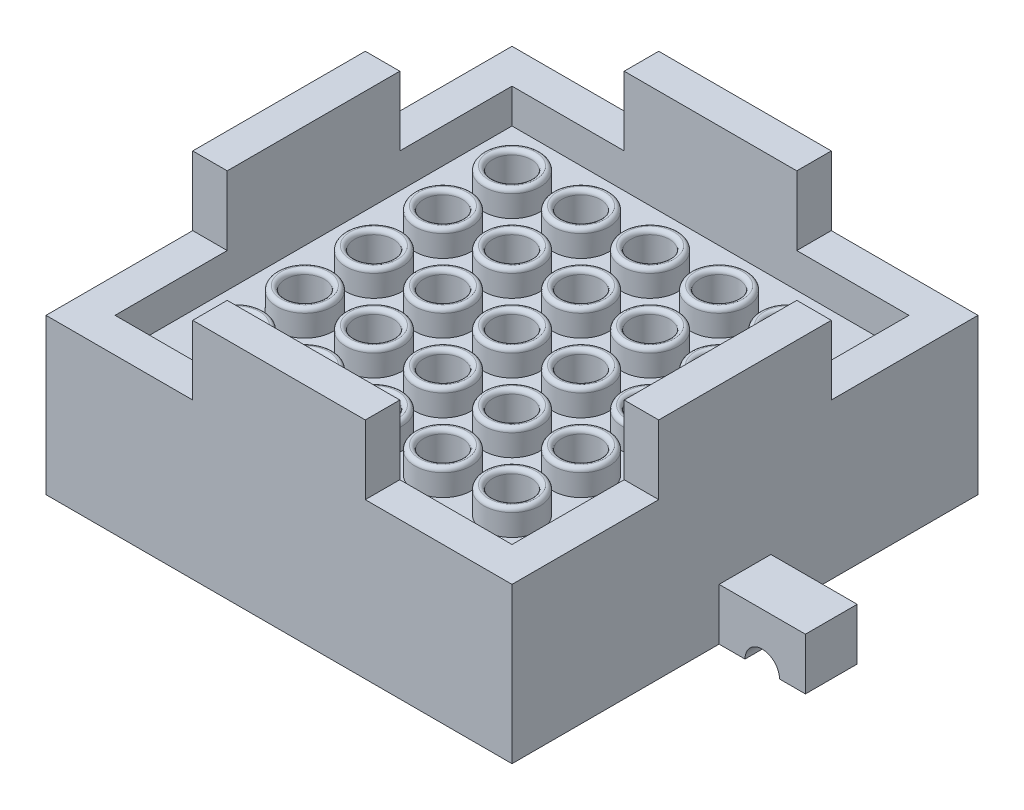
from build123d import *

# Parameters (mm, degrees)
SKETCH1_W              = 27
SKETCH1_H              = 27
SKETCH1_W_2            = 23
SKETCH1_H_2            = 23
BOSS_EXTRUDE1_DEPTH    = 2
SKETCH2_W              = 27
SKETCH2_H              = 27
BOSS_EXTRUDE2_DEPTH    = 2
SKETCH3_W              = 27
SKETCH3_H              = 27
SKETCH3_W_2            = 23
SKETCH3_H_2            = 23
BOSS_EXTRUDE3_DEPTH    = 3
SKETCH6_R              = 1.625
BOSS_EXTRUDE5_DEPTH    = 1.5
CUT_EXTRUDE2_REACH     = 22.168
SKETCH7_R              = 1.125
FILLET1_R              = 0.25
LPATTERN3_COUNT        = 5
LPATTERN3_PITCH        = 4
LPATTERN3_COUNT_DIR2   = 5
LPATTERN3_PITCH_DIR2   = 4
FILLET1_OF_LPATTERN3_R = 0.25
SKETCH11_R             = 0.75
BOSS_EXTRUDE8_DEPTH    = 3
LPATTERN2_COUNT        = 6
LPATTERN2_PITCH        = 4
LPATTERN2_COUNT_DIR2   = 6
LPATTERN2_PITCH_DIR2   = 4
SKETCH8_W              = 27
SKETCH8_H              = 27
BOSS_EXTRUDE6_DEPTH    = 2
SKETCH9_R              = 4.25
CUT_EXTRUDE3_DEPTH     = 5
SKETCH10_W             = 2
SKETCH10_H             = 10
BOSS_EXTRUDE7_DEPTH    = 4
CIRPATTERN2_COUNT      = 4
SKETCH12_W             = 3
SKETCH12_H             = 3
BOSS_EXTRUDE9_DEPTH    = 5
CUT_EXTRUDE4_START     = -3
CUT_EXTRUDE4_DEPTH     = 3
CUT_EXTRUDE4_2_DEPTH   = 3


# Read off the part's stored shape, not the designer's step: Cut-Extrude4
with BuildPart() as part:
    # Sketch1 → Boss-Extrude1 (new body)
    with BuildSketch(Plane(origin=(0, 0, 0), x_dir=(1, 0, 0), z_dir=(0, 1, 0))):
        Rectangle(SKETCH1_W, SKETCH1_H)
        Rectangle(SKETCH1_W_2, SKETCH1_H_2, mode=Mode.SUBTRACT)
    extrude(amount=BOSS_EXTRUDE1_DEPTH)

    # Sketch2 → Boss-Extrude2 (add)
    with BuildSketch(Plane.XZ):
        Rectangle(SKETCH2_W, SKETCH2_H)
    extrude(amount=BOSS_EXTRUDE2_DEPTH)

    # Sketch3 → Boss-Extrude3 (add)
    with BuildSketch(Plane.XZ.offset(2)):
        Rectangle(SKETCH3_W, SKETCH3_H)
        Rectangle(SKETCH3_W_2, SKETCH3_H_2, mode=Mode.SUBTRACT)
    extrude(amount=BOSS_EXTRUDE3_DEPTH)

    # Sketch6 → Boss-Extrude5 (add)
    with BuildSketch(Plane(origin=(0, 0, 0), x_dir=(1, 0, 0), z_dir=(0, 1, 0))):
        with Locations(Location((8, 8, 0), (0, 0, 90))):
            Circle(SKETCH6_R)
    boss_extrude5 = extrude(amount=BOSS_EXTRUDE5_DEPTH)

    # Sketch7 → Cut-Extrude2 (cut, up to next)
    with BuildSketch(Plane(origin=(0, 1.5, 0), x_dir=(1, 0, 0), z_dir=(0, 1, 0)), mode=Mode.PRIVATE) as cut_extrude2_sk1:
        with Locations(Location((8, 8, 0), (0, 0, 270))):
            Circle(SKETCH7_R)
    cut_extrude2_tool1 = extrude(cut_extrude2_sk1.sketch, amount=-CUT_EXTRUDE2_REACH, mode=Mode.PRIVATE) & part.part
    cut_extrude2 = cut_extrude2_tool1.solids().sort_by_distance((8, 1.5, -8))[0]
    add(cut_extrude2, mode=Mode.SUBTRACT)

    # Fillet1
    fillet1_edges = [part.edges().sort_by_distance(p)[0] for p in [
        (8, 1.5, -6.375),
        (8, 1.5, -9.125),
    ]]
    fillet(fillet1_edges, radius=FILLET1_R - 0.0001)  # a hair under: the kernel refuses the full size

    # LPattern3: Boss-Extrude5, Cut-Extrude2 5 × 5
    with Locations(*[(-j * LPATTERN3_PITCH_DIR2, 0, i * LPATTERN3_PITCH) for i in range(LPATTERN3_COUNT) for j in range(LPATTERN3_COUNT_DIR2) if (i, j) != (0, 0)]):
        add(boss_extrude5)
        add(cut_extrude2, mode=Mode.SUBTRACT)

    # Fillet1 of LPattern3
    fillet1_of_lpattern3_edges = [part.edges().sort_by_distance(p)[0] for p in [
        (4, 1.5, -6.375),
        (4, 1.5, -9.125),
        (0, 1.5, -6.375),
        (0, 1.5, -9.125),
        (-4, 1.5, -6.375),
        (-4, 1.5, -9.125),
        (-8, 1.5, -6.375),
        (-8, 1.5, -9.125),
        (8, 1.5, -2.375),
        (8, 1.5, -5.125),
        (4, 1.5, -2.375),
        (4, 1.5, -5.125),
        (0, 1.5, -2.375),
        (0, 1.5, -5.125),
        (-4, 1.5, -2.375),
        (-4, 1.5, -5.125),
        (-8, 1.5, -2.375),
        (-8, 1.5, -5.125),
        (8, 1.5, 1.625),
        (8, 1.5, -1.125),
        (4, 1.5, 1.625),
        (4, 1.5, -1.125),
        (0, 1.5, 1.625),
        (0, 1.5, -1.125),
        (-4, 1.5, 1.625),
        (-4, 1.5, -1.125),
        (-8, 1.5, 1.625),
        (-8, 1.5, -1.125),
        (8, 1.5, 5.625),
        (8, 1.5, 2.875),
        (4, 1.5, 5.625),
        (4, 1.5, 2.875),
        (0, 1.5, 5.625),
        (0, 1.5, 2.875),
        (-4, 1.5, 5.625),
        (-4, 1.5, 2.875),
        (-8, 1.5, 5.625),
        (-8, 1.5, 2.875),
        (8, 1.5, 9.625),
        (8, 1.5, 6.875),
        (4, 1.5, 9.625),
        (4, 1.5, 6.875),
        (0, 1.5, 9.625),
        (0, 1.5, 6.875),
        (-4, 1.5, 9.625),
        (-4, 1.5, 6.875),
        (-8, 1.5, 9.625),
        (-8, 1.5, 6.875),
    ]]
    fillet(fillet1_of_lpattern3_edges, radius=FILLET1_OF_LPATTERN3_R - 0.0001)  # a hair under: the kernel refuses the full size

    # Sketch11 → Boss-Extrude8 (add)
    with BuildSketch(Plane.XZ.offset(2)):
        with Locations(Location((-9.9, 9.9, 0), (0, 0, 90))):
            Circle(SKETCH11_R)
    boss_extrude8 = extrude(amount=BOSS_EXTRUDE8_DEPTH)

    # LPattern2: Boss-Extrude8 6 × 6
    with Locations(*[(i * LPATTERN2_PITCH, 0, -j * LPATTERN2_PITCH_DIR2) for i in range(LPATTERN2_COUNT) for j in range(LPATTERN2_COUNT_DIR2) if (i, j) != (0, 0)]):
        add(boss_extrude8)

    # Sketch8 → Boss-Extrude6 (add)
    with BuildSketch(Plane.XZ.offset(5)):
        Rectangle(SKETCH8_W, SKETCH8_H)
    extrude(amount=BOSS_EXTRUDE6_DEPTH)

    # Sketch9 → Cut-Extrude3 (cut)
    with BuildSketch(Plane.XZ.offset(7)):
        with Locations(Location((0, 0, 0), (0, 0, 270))):
            Circle(SKETCH9_R)
    extrude(amount=-CUT_EXTRUDE3_DEPTH, mode=Mode.SUBTRACT)

    # Sketch10 → Boss-Extrude7 (add)
    with BuildSketch(Plane(origin=(0, 2, 0), x_dir=(1, 0, 0), z_dir=(0, 1, 0))):
        with Locations((-12.5, 0)):
            Rectangle(SKETCH10_W, SKETCH10_H)
    boss_extrude7 = extrude(amount=BOSS_EXTRUDE7_DEPTH)

    # CirPattern2: Boss-Extrude7 ×4 about axis
    cirpattern2_axis = Axis((0, 0, 0), (0, 1, 0))
    for i in range(1, CIRPATTERN2_COUNT):
        add(boss_extrude7.rotate(cirpattern2_axis, i * 360 / CIRPATTERN2_COUNT))

    # Sketch12 → Boss-Extrude9 (add)
    with BuildSketch(Plane.ZY.offset(13.5)):
        with Locations((0, -5.5)):
            Rectangle(SKETCH12_W, SKETCH12_H)
    extrude(amount=BOSS_EXTRUDE9_DEPTH)

    # Cut-Extrude4 outline → Cut-Extrude4 (cut)
    with BuildSketch(Plane.XY.offset(1.5).offset(CUT_EXTRUDE4_START)):
        with BuildLine():
            Line((-17, -7), (-15, -7))
            ThreePointArc((-15, -7), (-16, -6), (-17, -7))
        make_face()
    extrude(amount=CUT_EXTRUDE4_DEPTH, mode=Mode.SUBTRACT)

    # Cut-Extrude4 2 outline → Cut-Extrude4 2 (add)
    with BuildSketch(Plane.XY.offset(1.5).offset(CUT_EXTRUDE4_START)):
        with BuildLine():
            Line((17, -7), (18.5, -7))
            Line((18.5, -7), (18.5, -4))
            Line((18.5, -4), (13.5, -4))
            Line((13.5, -4), (13.5, -7))
            Line((13.5, -7), (15, -7))
            ThreePointArc((15, -7), (16, -6), (17, -7))
        make_face()
    extrude(amount=CUT_EXTRUDE4_2_DEPTH)


solid = part.part
